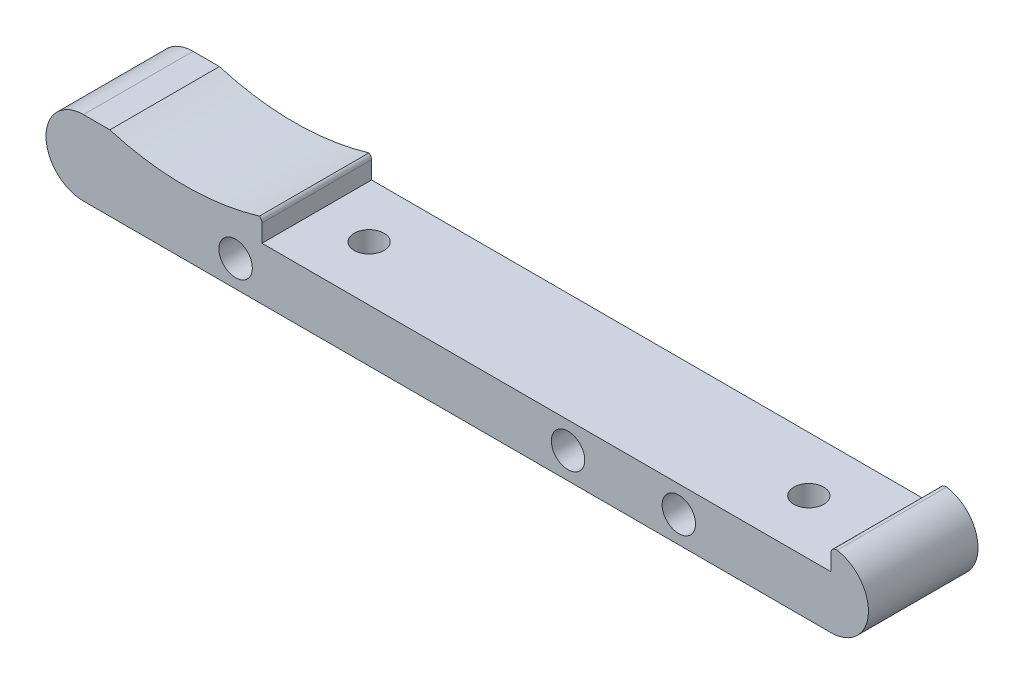
from build123d import *

# Parameters (mm, degrees)
SKETCH1_R           = 2.413
BOSS_EXTRUDE1_DEPTH = 15.8242
SKETCH3_R           = 2.159
CUT_EXTRUDE1_DEPTH  = 7.62
CUT_EXTRUDE2_DEPTH  = 15.8242
FILLET1_R           = 0.762


with BuildPart() as part:
    # Sketch1 → Boss-Extrude1 (new body)
    with BuildSketch(Plane.XY):
        with BuildLine():
            Line((0, 0), (107.95, 0))
            ThreePointArc((107.95, 0), (113.3602, 5.4102), (107.95, 10.8204))
            Line((107.95, 10.8204), (107.95, 7.62))
            Line((107.95, 7.62), (25.781, 7.62))
            Line((25.781, 7.62), (25.781, 10.8204))
            Line((25.781, 10.8204), (0, 10.8204))
            ThreePointArc((0, 10.8204), (-5.4102, 5.4102), (0, 0))
        make_face()
        with Locations((21.971, 3.81)):
            Circle(SKETCH1_R, mode=Mode.SUBTRACT)
        with Locations((69.977, 3.81)):
            Circle(SKETCH1_R, mode=Mode.SUBTRACT)
        with Locations((85.979, 3.81)):
            Circle(SKETCH1_R, mode=Mode.SUBTRACT)
    extrude(amount=BOSS_EXTRUDE1_DEPTH)

    # Sketch3 → Cut-Extrude1 (cut)
    with BuildSketch(Plane(origin=(0, 7.62, 0), x_dir=(1, 0, 0), z_dir=(0, 1, 0))):
        with Locations(Location((96.8375, -7.9121, 0), (0, 0, 270))):
            Circle(SKETCH3_R)
        with Locations(Location((33.3375, -7.9121, 0), (0, 0, 270))):
            Circle(SKETCH3_R)
    extrude(amount=-CUT_EXTRUDE1_DEPTH, mode=Mode.SUBTRACT)

    # Sketch4 → Cut-Extrude2 (cut)
    with BuildSketch(Plane(origin=(0, 0, 0), x_dir=(-1, 0, 0), z_dir=(0, 0, -1))):
        with BuildLine():
            Line((-3.81, 10.8204), (-25.4, 10.8204))
            ThreePointArc((-25.4, 10.8204), (-14.605, 9.241326758), (-3.81, 10.8204))
        make_face()
    extrude(amount=-CUT_EXTRUDE2_DEPTH, mode=Mode.SUBTRACT)

    # Fillet1
    # the kernel refuses this fillet: 0.762 mm, written as the material it takes off along each edge
    with BuildSketch(Plane(origin=(107.95, 10.8204, -2.224832658), x_dir=(0.9966120705297453, -0.08224585627503565, 0), z_dir=(0, 0, 1))) as fillet1_piece_1:
        with BuildLine():
            CenterArc((0.827261721, -0.759418398), FILLET1_R, 85.282330638, 99.435338723)
            Line((0.067843323, -0.82208974), (0.052654955, -0.823343167))
            Line((0.052654955, -0.823343167), (-0.015188368, -0.001253427))
            Line((-0.015188368, -0.001253427), (-0.001253427, 0.015188368))
            ThreePointArc((-0.001253427, 0.015188368), (0.444966532, 0.033569376), (0.89118649, 0.015188368))
            Line((0.89118649, 0.015188368), (0.889933063, 0))
        make_face()
    extrude(amount=20.273865316, mode=Mode.SUBTRACT)
    with BuildSketch(Plane(origin=(25.781, 10.8204, -1.649778394), x_dir=(-1, 0, 0), z_dir=(0, 0, 1))) as fillet1_piece_2:
        with BuildLine():
            CenterArc((0.762, 0.659911358), FILLET1_R, 180, 60)
            Line((0, 0.659911358), (-0.01524, 0.659911358))
            Line((-0.01524, 0.659911358), (-0.01524, 0))
            Line((-0.01524, 0), (0, -0.01524))
            ThreePointArc((0, -0.01524), (0.1905, -0.01524), (0.37338, -0.013198227))
            Line((0.37338, -0.013198227), (0.381, 0))
        make_face()
    extrude(amount=19.123756788, mode=Mode.SUBTRACT)


solid = part.part
